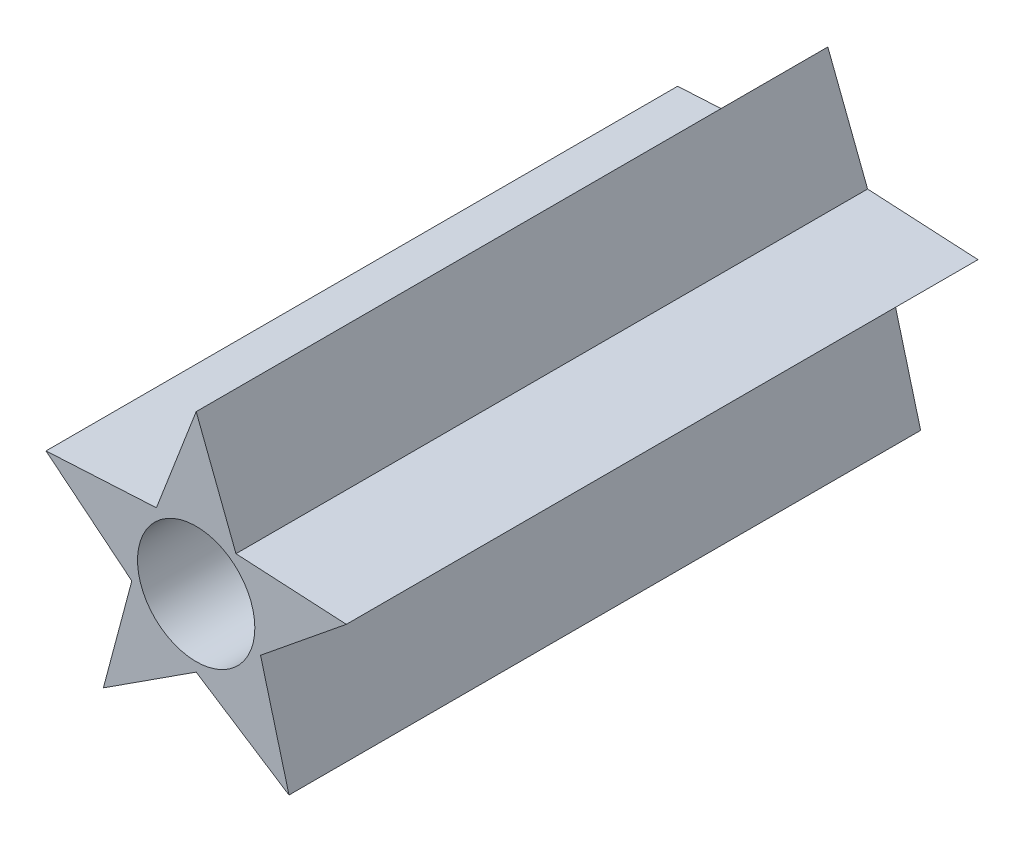
from build123d import *

# Parameters (mm, degrees)
BOSS_EXTRUDE1_DEPTH = 70
CUT_EXTRUDE1_DEPTH  = 75.049008955


with BuildPart() as part:
    # Sketch1 → Boss-Extrude1 (new body)
    with BuildSketch(Plane.XY):
        Polygon((0, 17.5), (-4.408389392, 6.067627458), (-16.643489035, 5.407797402), (-7.132923872, -2.317627458), (-10.286241915, -14.157797402), (0, -7.5), (10.286241915, -14.157797402), (7.132923872, -2.317627458), (16.643489035, 5.407797402), (4.408389392, 6.067627458), align=None)
    extrude(amount=BOSS_EXTRUDE1_DEPTH)

    # Sketch2 → Cut-Extrude1 (cut, through all)
    with BuildSketch(Plane.XY.offset(70)):
        with BuildLine():
            ThreePointArc((3.82060414, 5.258610463), (-5.791542407, -2.950938248), (6.5, 0))
            ThreePointArc((6.5, 0), (5.791542407, 2.950938248), (3.82060414, 5.258610463))
        make_face()
    extrude(amount=-CUT_EXTRUDE1_DEPTH, mode=Mode.SUBTRACT)


solid = part.part
